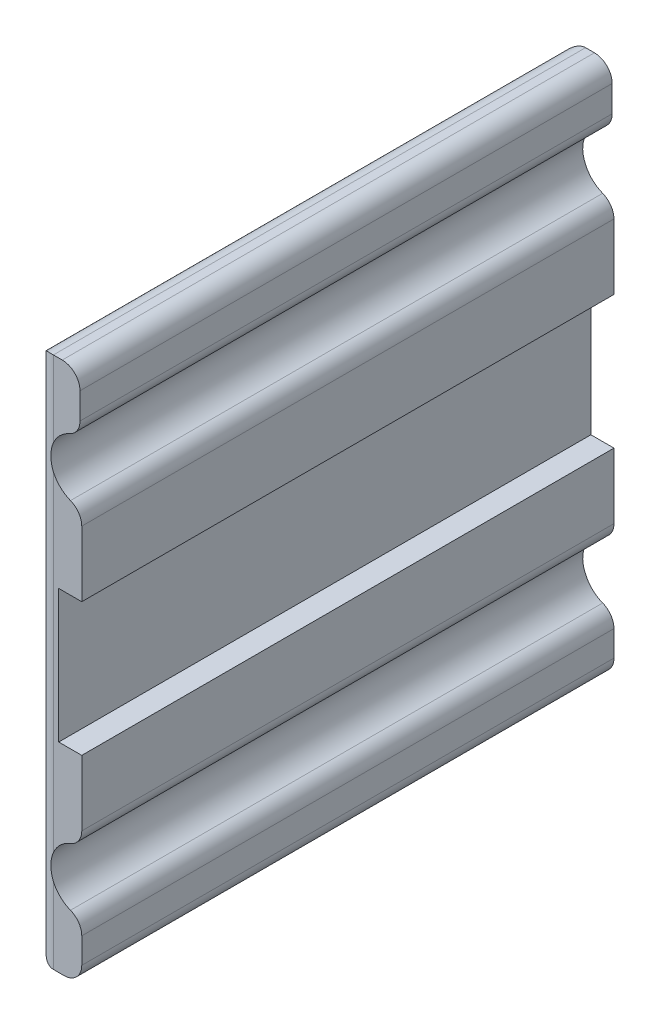
from build123d import *

# Parameters (mm, degrees)
SALIENTE_EXTRUIR1_DEPTH       = 30
REDONDEO1_R                   = 2
SALIENTE_EXTRUIR2_START       = -3.5
SALIENTE_EXTRUIR2_DEPTH       = 7
SALIENTE_EXTRUIR2_START_2     = -15.187316551
SALIENTE_EXTRUIR2_2_DEPTH     = 29.673057242
SALIENTE_EXTRUIR2_START_3     = -18
SALIENTE_EXTRUIR2_3_OUTLINE_W = 26
SALIENTE_EXTRUIR2_3_OUTLINE_H = 32
SALIENTE_EXTRUIR2_3_DEPTH     = 33.799218947
SALIENTE_EXTRUIR4_DEPTH       = 0.5
REDONDEO6_R                   = 0.5
SALIENTE_EXTRUIR5_DEPTH       = 0.5
REDONDEO7_R                   = 0.5
REDONDEO8_R                   = 1
REDONDEO9_R                   = 2
CROQUIS6_W                    = 2.6
CROQUIS6_H                    = 15
CORTAR_EXTRUIR1_DEPTH         = 68.29903431


with BuildPart() as part:
    # Croquis1 → Saliente-Extruir1 (new, symmetric)
    with BuildSketch(Plane.XY):
        with BuildLine():
            Line((2.6, -23.497140521), (2.6, -30))
            Line((2.6, -30), (-2.6, -30))
            Line((-2.6, -30), (-2.6, 30))
            Line((-2.6, 30), (2.4, 30))
            Line((2.4, 30), (2.4, 23.497140521))
            ThreePointArc((2.4, 23.497140521), (-0.898569968, 19.902818604), (2.6, 16.502859479))
            Line((2.6, 16.502859479), (2.6, 7.502859479))
            Line((2.6, 7.502859479), (0, 7.502859479))
            Line((0, 7.502859479), (0, -7.497140521))
            Line((0, -7.497140521), (2.6, -7.497140521))
            Line((2.6, -7.497140521), (2.6, -16.497140521))
            ThreePointArc((2.6, -16.497140521), (-0.9, -19.997140521), (2.6, -23.497140521))
        make_face()
    extrude(amount=SALIENTE_EXTRUIR1_DEPTH, both=True)

    # Redondeo1
    # the kernel refuses this fillet: 2 mm, written as the material it takes off along each edge
    with BuildSketch(Plane(origin=(-2.6, -35, 30), x_dir=(1, 0, 0), z_dir=(0, 1, 0)), Plane(origin=(-2.6, -35, -30), x_dir=(0, 0, 1), z_dir=(0, 1, 0)), Plane(origin=(2.4, 30, 35), x_dir=(0, -1, 0), z_dir=(0, 0, -1)), Plane(origin=(-2.6, 30, 35), x_dir=(1, 0, 0), z_dir=(0, 0, -1)), Plane(origin=(-2.6, -30, 35), x_dir=(0, 1, 0), z_dir=(0, 0, -1)), Plane(origin=(2.6, -30, 35), x_dir=(-1, 0, 0), z_dir=(0, 0, -1))) as redondeo1_piece_1:
        with BuildLine():
            CenterArc((REDONDEO1_R, REDONDEO1_R), REDONDEO1_R, 180, 90)
            Line((0, REDONDEO1_R), (0, 0))
            Line((0, 0), (REDONDEO1_R, 0))
        make_face()
    extrude(amount=70, mode=Mode.SUBTRACT)
    with BuildSketch(Plane(origin=(2.6, -23.497140521, 34.058688457), x_dir=(0, -1, 0), z_dir=(0, 0, -1))) as redondeo1_piece_2:
        with BuildLine():
            CenterArc((1.623475383, 2), REDONDEO1_R, 201.323686263, 68.676313737)
            ThreePointArc((-0.239606574, 1.272727273), (-0.06042321, 0.647542667), (0, 0))
            Line((0, 0), (1.623475383, 0))
        make_face()
    extrude(amount=68.117376915, mode=Mode.SUBTRACT)
    with BuildSketch(Plane(origin=(2.4, 23.497140521, 33.866380556), x_dir=(-0.9726665465042704, -0.23220635071301512, 0), z_dir=(0, 0, -1))) as redondeo1_piece_3:
        with BuildLine():
            CenterArc((1.586213845, 1.968692311), REDONDEO1_R, 193.427003719, 66.421821522)
            Line((-0.359119248, 1.504279609), (0, 0))
            ThreePointArc((0, 0), (0.61686094, 0.054788456), (1.23372188, 0))
        make_face()
    extrude(amount=67.732761113, mode=Mode.SUBTRACT)

    # Redondeo9
    redondeo9_edges = [part.edges().sort_by_distance(p)[0] for p in [
        (2.6, -16.497140521, 0),
        (2.6, 16.502859479, 0),
    ]]
    fillet(redondeo9_edges, radius=REDONDEO9_R)


with BuildPart() as body_2:
    # Saliente-Extruir2: read off the stored shape, not the designer's step
    # Saliente-Extruir2 outline → Saliente-Extruir2 (new body)
    with BuildSketch(Plane(origin=(0, 0, 0), x_dir=(1, 0, 0), z_dir=(0, 1, 0)).offset(SALIENTE_EXTRUIR2_START)):
        Polygon((2.6, 0), (-1.4, 14.92820323), (-5.4, 0), (-1.4, -14.92820323), align=None)
    extrude(amount=SALIENTE_EXTRUIR2_DEPTH)

    # Saliente-Extruir2 2 outline → Saliente-Extruir2 2 (add)
    with BuildSketch(Plane(origin=(0, 0, 0), x_dir=(0.9681003458863747, 0.06485042646813632, 0.24202508647159393), z_dir=(0.25056280708573186, -0.25056280708573186, -0.9351131265310292)).offset(SALIENTE_EXTRUIR2_START_2)):
        Polygon((2.030682701, 7.244443697), (-5.714120066, 7.244443697), (-4.741363669, -7.244443697), (3.003439098, -7.244443697), align=None)
    extrude(amount=SALIENTE_EXTRUIR2_2_DEPTH)

    # Saliente-Extruir2 3 outline → Saliente-Extruir2 3 (cut)
    with BuildSketch(Plane(origin=(0, 0, 0), x_dir=(0.9681003458863747, 0.06485042646813632, -0.24202508647159393), z_dir=(0.25056280708573186, -0.25056280708573186, 0.9351131265310292)).offset(SALIENTE_EXTRUIR2_START_3)):
        with Locations((-1, 0)):
            Rectangle(SALIENTE_EXTRUIR2_3_OUTLINE_W, SALIENTE_EXTRUIR2_3_OUTLINE_H)
        Polygon((3.003439098, 7.244443697), (2.030682701, -7.244443697), (-5.714120066, -7.244443697), (-4.741363669, 7.244443697), align=None, mode=Mode.SUBTRACT)
    extrude(amount=SALIENTE_EXTRUIR2_3_DEPTH, mode=Mode.SUBTRACT)

    # Croquis4 → Saliente-Extruir4 (add)
    with BuildSketch(Plane(origin=(0.486941537, 0, -21.970364919), x_dir=(0.25881904510252135, 0, -0.9659258262890682), z_dir=(0.9659258262890681, 0, 0.2588190451025213))):
        with BuildLine():
            Line((-16.745395475, -2.021015706), (-16.745395475, -2.619091917))
            Line((-16.745395475, -2.619091917), (-12.245395475, -0.021015706))
            Line((-12.245395475, -0.021015706), (-16.745395475, 2.577060506))
            Line((-16.745395475, 2.577060506), (-16.745395475, 1.978984294))
            ThreePointArc((-16.745395475, 1.978984294), (-17.038288694, 1.271877513), (-17.745395475, 0.978984294))
            Line((-17.745395475, 0.978984294), (-19.745395475, 0.978984294))
            Line((-19.745395475, 0.978984294), (-19.745395475, -1.021015706))
            Line((-19.745395475, -1.021015706), (-17.745395475, -1.021015706))
            ThreePointArc((-17.745395475, -1.021015706), (-17.038288694, -1.313908925), (-16.745395475, -2.021015706))
        make_face()
    extrude(amount=-SALIENTE_EXTRUIR4_DEPTH)

    # Redondeo6
    # the kernel refuses this fillet: 0.5 mm, written as the material it takes off along each edge
    with BuildSketch(Plane(origin=(-4.588867688, 0.978984294, -4.959038654), x_dir=(0.9659258262890682, 0, 0.2588190451025214), z_dir=(-0.25881904510252135, 0, 0.9659258262890682)), Plane(origin=(-5.430029584, -1.021015706, -1.819779719), x_dir=(0.9659258262890682, 0, 0.2588190451025214), z_dir=(0.25881904510252135, 0, -0.9659258262890682))) as redondeo6_piece_1:
        with BuildLine():
            CenterArc((REDONDEO6_R, -REDONDEO6_R), REDONDEO6_R, 90, 90)
            Line((0, -REDONDEO6_R), (0, 0))
            Line((0, 0), (REDONDEO6_R, 0))
        make_face()
    extrude(amount=3.25, mode=Mode.SUBTRACT)
    with BuildSketch(Plane(origin=(-5.106505778, 2.228984294, -3.027187001), x_dir=(0.9659258262890685, 0, 0.2588190451025201), z_dir=(0, -1, 0))) as redondeo6_piece_2:
        with BuildLine():
            CenterArc((REDONDEO6_R, -REDONDEO6_R), REDONDEO6_R, 90, 90)
            Line((0, -REDONDEO6_R), (0, 0))
            Line((0, 0), (REDONDEO6_R, 0))
        make_face()
    extrude(amount=4.5, mode=Mode.SUBTRACT)
    with BuildSketch(Plane(origin=(-4.588867688, -2.021015706, -4.959038654), x_dir=(0, 1, 0), z_dir=(-0.25881904510252135, -7.32307077246263e-15, 0.9659258262890682))) as redondeo6_piece_3:
        with BuildLine():
            CenterArc((1 + REDONDEO6_R, -REDONDEO6_R), REDONDEO6_R, 90, 90)
            Line((1 + REDONDEO6_R, 0), (1, 0))
            Line((1, 0), (1, -REDONDEO6_R))
        make_face()
    revolve(axis=Axis((-4.588867688, -2.021015706, -4.959038654), (-0.9659258262890682, 0, -0.25881904510252135)), revolution_arc=90, mode=Mode.SUBTRACT)
    with BuildSketch(Plane(origin=(-4.610228478, -3.244091917, -4.879319101), x_dir=(0.9659258262890678, 2.238086743988656e-15, 0.25881904510252257), z_dir=(0.2241438680420138, 0.5000000000000003, -0.8365163037378075)), Plane(origin=(-2.885183105, -0.646015706, -11.317276078), x_dir=(0.9659258262890683, 0, 0.2588190451025209), z_dir=(-0.22414386804201394, 0.49999999999999983, 0.8365163037378079))) as redondeo6_piece_4:
        with BuildLine():
            CenterArc((REDONDEO6_R, -REDONDEO6_R), REDONDEO6_R, 90, 90)
            Line((0, -REDONDEO6_R), (0, 0))
            Line((0, 0), (REDONDEO6_R, 0))
        make_face()
    extrude(amount=7.696152423, mode=Mode.SUBTRACT)
    with BuildSketch(Plane(origin=(-4.588867688, 1.978984294, -4.959038654), x_dir=(0.2588190451025222, 3.108624468950456e-15, -0.9659258262890679), z_dir=(0, 1, 0))) as redondeo6_piece_5:
        with BuildLine():
            CenterArc((1 + REDONDEO6_R, -REDONDEO6_R), REDONDEO6_R, 90, 90)
            Line((1 + REDONDEO6_R, 0), (1, 0))
            Line((1, 0), (1, -REDONDEO6_R))
        make_face()
    revolve(axis=Axis((-4.588867688, 1.978984294, -4.959038654), (-0.9659258262890682, 0, -0.25881904510252135)), revolution_arc=90, mode=Mode.SUBTRACT)
    with BuildSketch(Plane(origin=(-4.330048643, 3.827060506, -5.92496448), x_dir=(0.9659258262890695, 0, 0.2588190451025165), z_dir=(0, -1, 0)), Plane(origin=(-4.330048643, -2.021015706, -5.92496448), x_dir=(0.9659258262890695, 0, 0.2588190451025165), z_dir=(0, -1, 0))) as redondeo6_piece_6:
        with BuildLine():
            CenterArc((REDONDEO6_R, -REDONDEO6_R), REDONDEO6_R, 90, 90)
            Line((0, -REDONDEO6_R), (0, 0))
            Line((0, 0), (REDONDEO6_R, 0))
        make_face()
    extrude(amount=1.848076211, mode=Mode.SUBTRACT)

    # Croquis5 → Saliente-Extruir5 (add)
    with BuildSketch(Plane(origin=(-5.03826859, 0, 1.35), x_dir=(0.25881904510252135, 0, 0.9659258262890682), z_dir=(-0.9659258262890681, 0, 0.2588190451025213))):
        with BuildLine():
            Line((4.602377156, -2), (4.602377156, -2.598076211))
            Line((4.602377156, -2.598076211), (9.102377156, 0))
            Line((9.102377156, 0), (4.602377156, 2.598076211))
            Line((4.602377156, 2.598076211), (4.602377156, 2))
            ThreePointArc((4.602377156, 2), (4.309483938, 1.292893219), (3.602377156, 1))
            Line((3.602377156, 1), (1.602377156, 1))
            Line((1.602377156, 1), (1.602377156, -1))
            Line((1.602377156, -1), (3.602377156, -1))
            ThreePointArc((3.602377156, -1), (4.309483938, -1.292893219), (4.602377156, -2))
        make_face()
    extrude(amount=SALIENTE_EXTRUIR5_DEPTH)

    # Redondeo7
    # the kernel refuses this fillet: 0.5 mm, written as the material it takes off along each edge
    with BuildSketch(Plane(origin=(-4.588867688, 2, 4.959038654), x_dir=(0.2588190451025221, 1.5543122344752223e-15, 0.9659258262890679), z_dir=(0, 1, 0))) as redondeo7_piece_1:
        with BuildLine():
            CenterArc((1 + REDONDEO7_R, REDONDEO7_R), REDONDEO7_R, 180, 90)
            Line((1 + REDONDEO7_R, 0), (1, 0))
            Line((1, 0), (1, REDONDEO7_R))
        make_face()
    revolve(axis=Axis((-4.588867688, 2, 4.959038654), (0.9659258262890682, 0, -0.25881904510252135)), revolution_arc=90, mode=Mode.SUBTRACT)
    with BuildSketch(Plane(origin=(-2.885183105, -0.625, 11.317276078), x_dir=(0.965925826289068, 0, -0.2588190451025217), z_dir=(-0.22414386804201394, 0.49999999999999967, -0.8365163037378079)), Plane(origin=(-4.610228478, -3.223076211, 4.879319101), x_dir=(0.9659258262890681, 0, -0.25881904510252185), z_dir=(0.2241438680420139, 0.4999999999999999, 0.8365163037378078))) as redondeo7_piece_2:
        with BuildLine():
            CenterArc((REDONDEO7_R, REDONDEO7_R), REDONDEO7_R, 180, 90)
            Line((0, REDONDEO7_R), (0, 0))
            Line((0, 0), (REDONDEO7_R, 0))
        make_face()
    extrude(amount=7.696152423, mode=Mode.SUBTRACT)
    with BuildSketch(Plane(origin=(-4.588867688, -2, 4.959038654), x_dir=(0, 1, 0), z_dir=(-0.25881904510252135, 0, -0.9659258262890682))) as redondeo7_piece_3:
        with BuildLine():
            CenterArc((1 + REDONDEO7_R, REDONDEO7_R), REDONDEO7_R, 180, 90)
            Line((1 + REDONDEO7_R, 0), (1, 0))
            Line((1, 0), (1, REDONDEO7_R))
        make_face()
    revolve(axis=Axis((-4.588867688, -2, 4.959038654), (0.9659258262890682, 0, -0.25881904510252135)), revolution_arc=90, mode=Mode.SUBTRACT)
    with BuildSketch(Plane(origin=(-5.430029584, -1, 1.819779719), x_dir=(0.9659258262890682, 0, -0.2588190451025214), z_dir=(0.25881904510252135, 0, 0.9659258262890682)), Plane(origin=(-4.588867688, 1, 4.959038654), x_dir=(0.9659258262890681, 0, -0.2588190451025213), z_dir=(-0.25881904510252135, 0, -0.9659258262890682))) as redondeo7_piece_4:
        with BuildLine():
            CenterArc((REDONDEO7_R, REDONDEO7_R), REDONDEO7_R, 180, 90)
            Line((0, REDONDEO7_R), (0, 0))
            Line((0, 0), (REDONDEO7_R, 0))
        make_face()
    extrude(amount=3.25, mode=Mode.SUBTRACT)
    with BuildSketch(Plane(origin=(-5.106505778, 2.25, 3.027187001), x_dir=(0.9659258262890681, 0, -0.25881904510252174), z_dir=(0, -1, 0))) as redondeo7_piece_5:
        with BuildLine():
            CenterArc((REDONDEO7_R, REDONDEO7_R), REDONDEO7_R, 180, 90)
            Line((0, REDONDEO7_R), (0, 0))
            Line((0, 0), (REDONDEO7_R, 0))
        make_face()
    extrude(amount=4.5, mode=Mode.SUBTRACT)
    with BuildSketch(Plane(origin=(-4.330048643, -2, 5.92496448), x_dir=(0.9659258262890681, 0, -0.25881904510252174), z_dir=(0, -1, 0)), Plane(origin=(-4.330048643, 3.848076211, 5.92496448), x_dir=(0.9659258262890682, 0, -0.2588190451025215), z_dir=(0, -1, 0))) as redondeo7_piece_6:
        with BuildLine():
            CenterArc((REDONDEO7_R, REDONDEO7_R), REDONDEO7_R, 180, 90)
            Line((0, REDONDEO7_R), (0, 0))
            Line((0, 0), (REDONDEO7_R, 0))
        make_face()
    extrude(amount=1.848076211, mode=Mode.SUBTRACT)

    # Redondeo8
    redondeo8_edges = [body_2.edges().sort_by_distance(p)[0] for p in [
        (-3.4, 5.5, -7.464101615),
        (-3.4, 5.5, 7.464101615),
        (-3.4, -5.5, 7.464101615),
        (-3.4, -5.5, -7.464101615),
    ]]
    fillet(redondeo8_edges, radius=REDONDEO8_R)

    # Croquis6 → Cortar-Extruir1 (cut, through all)
    with BuildSketch(Plane.XY.offset(30)):
        with Locations((1.3, 0.002859479)):
            Rectangle(CROQUIS6_W, CROQUIS6_H)
    extrude(amount=-CORTAR_EXTRUIR1_DEPTH, mode=Mode.SUBTRACT)


solid = Compound([part.part, body_2.part])
